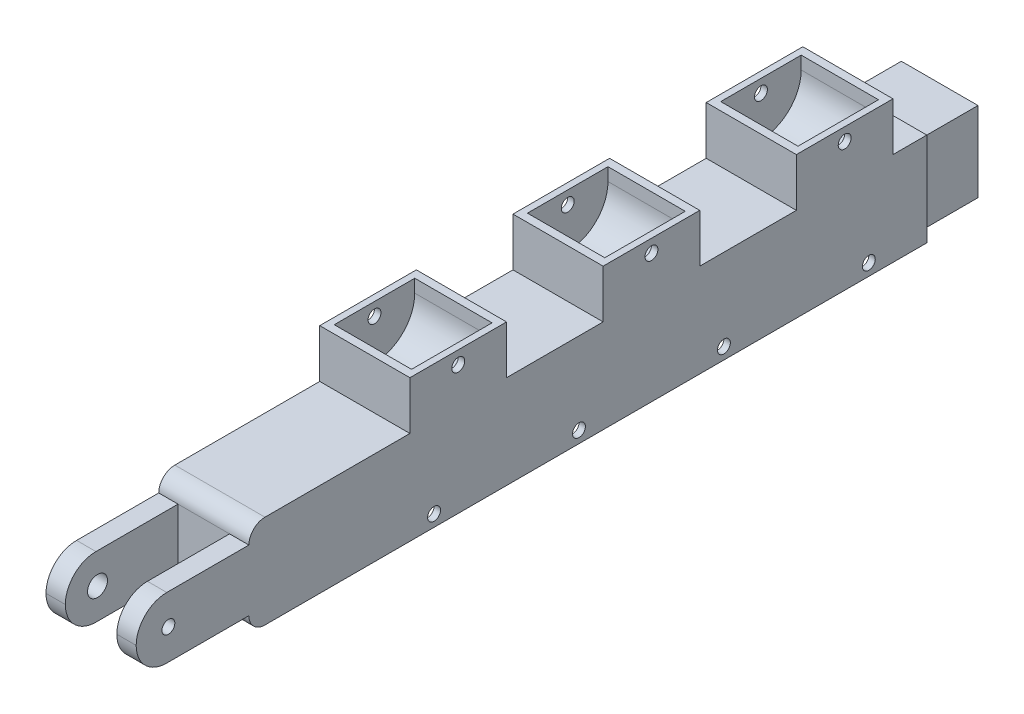
from build123d import *

# Parameters (mm, degrees)
SKETCH_1_W           = 250
SKETCH_1_H           = 29
SKETCH_1_W_2         = 30
SKETCH_1_H_2         = 15
EXTRUDE_1_DEPTH      = 28
SKETCH_1_3_R         = 2
CUT_EXTRUDE_1_DEPTH  = 132.450561049
CUT_EXTRUDE_START    = 2
SKETCH_1_5_R         = 2
CUT_EXTRUDE_2_DEPTH  = 24
SKETCH_3_W           = 6
SKETCH_3_H           = 19
EXTRUDE_2_DEPTH      = 35
SKETCH_3_3_W         = 6
SKETCH_3_3_H         = 19
EXTRUDE_3_DEPTH      = 35
SKETCH_1_6_R         = 2
CUT_EXTRUDE_3_DEPTH  = 166.088612569
CUT_EXTRUDE_7_REACH  = 167.089
SKETCH_1_8_R         = 3.1
FILLET_1_R           = 9.5
FILLET_2_R           = 5
SKETCH_4_R           = 5.1
CUT_EXTRUDE_4_DEPTH  = 31.5
SKETCH_4_2_OUTSIDE_W = 87.946
SKETCH_4_2_OUTSIDE_H = 103.946
SKETCH_4_2_OUTSIDE_R = 5.1
CUT_EXTRUDE_5_DEPTH  = 21.5
SKETCH_5_OUTSIDE_W   = 83.722
SKETCH_5_OUTSIDE_H   = 99.722
SKETCH_5_OUTSIDE_W_2 = 23.8
SKETCH_5_OUTSIDE_H_2 = 24.8
CUT_EXTRUDE_6_DEPTH  = 18


with BuildPart() as part:
    # 草图1 → 凸台-拉伸1 (new body)
    with BuildSketch(Plane(origin=(0, 0, 0), x_dir=(0, 0, -1), z_dir=(1, 0, 0))):
        Rectangle(SKETCH_1_W, SKETCH_1_H)
        with Locations((-60, 22)):
            Rectangle(SKETCH_1_W_2, SKETCH_1_H_2)
        with Locations((0, 22)):
            Rectangle(SKETCH_1_W_2, SKETCH_1_H_2)
        with Locations((60, 22)):
            Rectangle(SKETCH_1_W_2, SKETCH_1_H_2)
    extrude(amount=EXTRUDE_1_DEPTH)

    # 草图1<3> → 切除-拉伸1 (cut, through all)
    with BuildSketch(Plane(origin=(0, 0, 0), x_dir=(0, 0, -1), z_dir=(1, 0, 0))):
        with Locations((-67.5, -10.858617882)):
            Circle(SKETCH_1_3_R)
        with Locations((-22.5, -10.858617882)):
            Circle(SKETCH_1_3_R)
        with Locations((22.5, -10.858617882)):
            Circle(SKETCH_1_3_R)
        with Locations((-60, 25.5)):
            Circle(SKETCH_1_3_R)
        with Locations((67.5, -10.858617882)):
            Circle(SKETCH_1_3_R)
        with Locations((0, 25.5)):
            Circle(SKETCH_1_3_R)
        with Locations((60, 25.5)):
            Circle(SKETCH_1_3_R)
    extrude(amount=CUT_EXTRUDE_1_DEPTH, mode=Mode.SUBTRACT)

    # 草图1<5> → 切除-拉伸2 (cut)
    # profile 1 of 7: a face of its own
    with BuildSketch(Plane(origin=(0, 0, 0), x_dir=(0, 0, -1), z_dir=(1, 0, 0)).offset(CUT_EXTRUDE_START)):
        with BuildLine():
            Line((-72.5, 29.5), (-72.5, 25.5))
            ThreePointArc((-72.5, 25.5), (-60, 13), (-47.5, 25.5))
            Line((-47.5, 25.5), (-47.5, 29.5))
            Line((-47.5, 29.5), (-72.5, 29.5))
        make_face()
        with Locations((-60, 25.5)):
            Circle(SKETCH_1_5_R, mode=Mode.SUBTRACT)
    # profile 2 of 7: a face of its own
    with BuildSketch(Plane(origin=(0, 0, 0), x_dir=(0, 0, -1), z_dir=(1, 0, 0)).offset(CUT_EXTRUDE_START)):
        with BuildLine():
            Line((-79.457856675, -14.5), (-55.542143325, -14.5))
            ThreePointArc((-55.542143325, -14.5), (-67.5, 1.641382118), (-79.457856675, -14.5))
        make_face()
        with Locations((-67.5, -10.858617882)):
            Circle(SKETCH_1_5_R, mode=Mode.SUBTRACT)
    # profile 3 of 7: a face of its own
    with BuildSketch(Plane(origin=(0, 0, 0), x_dir=(0, 0, -1), z_dir=(1, 0, 0)).offset(CUT_EXTRUDE_START)):
        with BuildLine():
            Line((-34.457856675, -14.5), (-10.542143325, -14.5))
            ThreePointArc((-10.542143325, -14.5), (-22.5, 1.641382118), (-34.457856675, -14.5))
        make_face()
        with Locations((-22.5, -10.858617882)):
            Circle(SKETCH_1_5_R, mode=Mode.SUBTRACT)
    # profile 4 of 7: a face of its own
    with BuildSketch(Plane(origin=(0, 0, 0), x_dir=(0, 0, -1), z_dir=(1, 0, 0)).offset(CUT_EXTRUDE_START)):
        with BuildLine():
            ThreePointArc((-12.5, 25.5), (0, 13), (12.5, 25.5))
            Line((12.5, 25.5), (12.5, 29.5))
            Line((12.5, 29.5), (-12.5, 29.5))
            Line((-12.5, 29.5), (-12.5, 25.5))
        make_face()
        with Locations((0, 25.5)):
            Circle(SKETCH_1_5_R, mode=Mode.SUBTRACT)
    # profile 5 of 7: a face of its own
    with BuildSketch(Plane(origin=(0, 0, 0), x_dir=(0, 0, -1), z_dir=(1, 0, 0)).offset(CUT_EXTRUDE_START)):
        with BuildLine():
            Line((10.542143325, -14.5), (34.457856675, -14.5))
            ThreePointArc((34.457856675, -14.5), (22.5, 1.641382118), (10.542143325, -14.5))
        make_face()
        with Locations((22.5, -10.858617882)):
            Circle(SKETCH_1_5_R, mode=Mode.SUBTRACT)
    # profile 6 of 7: a face of its own
    with BuildSketch(Plane(origin=(0, 0, 0), x_dir=(0, 0, -1), z_dir=(1, 0, 0)).offset(CUT_EXTRUDE_START)):
        with BuildLine():
            Line((55.542143325, -14.5), (79.457856675, -14.5))
            ThreePointArc((79.457856675, -14.5), (67.5, 1.641382118), (55.542143325, -14.5))
        make_face()
        with Locations((67.5, -10.858617882)):
            Circle(SKETCH_1_5_R, mode=Mode.SUBTRACT)
    # profile 7 of 7: a face of its own
    with BuildSketch(Plane(origin=(0, 0, 0), x_dir=(0, 0, -1), z_dir=(1, 0, 0)).offset(CUT_EXTRUDE_START)):
        with BuildLine():
            ThreePointArc((47.5, 25.5), (60, 13), (72.5, 25.5))
            Line((72.5, 25.5), (72.5, 29.5))
            Line((72.5, 29.5), (47.5, 29.5))
            Line((47.5, 29.5), (47.5, 25.5))
        make_face()
        with Locations((60, 25.5)):
            Circle(SKETCH_1_5_R, mode=Mode.SUBTRACT)
    extrude(amount=CUT_EXTRUDE_2_DEPTH, mode=Mode.SUBTRACT)

    # 草图3 → 凸台-拉伸2 (add)
    with BuildSketch(Plane.XY.offset(125)):
        with Locations((25, 0)):
            Rectangle(SKETCH_3_W, SKETCH_3_H)
    extrude(amount=EXTRUDE_2_DEPTH)

    # 草图3<3> → 凸台-拉伸3 (add)
    with BuildSketch(Plane.XY.offset(125)):
        with Locations((25, 0)):
            Rectangle(SKETCH_3_3_W, SKETCH_3_3_H)
        with Locations((3, 0)):
            Rectangle(SKETCH_3_3_W, SKETCH_3_3_H)
    extrude(amount=EXTRUDE_3_DEPTH)

    # 草图1<6> → 切除-拉伸3 (cut, through all)
    with BuildSketch(Plane(origin=(0, 0, 0), x_dir=(0, 0, -1), z_dir=(1, 0, 0))):
        with Locations(Location((-150, 0, 0), (0, 0, 90))):
            Circle(SKETCH_1_6_R)
    extrude(amount=CUT_EXTRUDE_3_DEPTH, mode=Mode.SUBTRACT)

    # 草图1<8> → 切除-拉伸7 (cut, up to next)
    with BuildSketch(Plane(origin=(0, 0, 0), x_dir=(0, 0, -1), z_dir=(1, 0, 0)), mode=Mode.PRIVATE) as cut_extrude_7_sk1:
        with Locations(Location((-150, 0, 0), (0, 0, 180))):
            Circle(SKETCH_1_8_R)
    cut_extrude_7_tool1 = extrude(cut_extrude_7_sk1.sketch, amount=CUT_EXTRUDE_7_REACH, mode=Mode.PRIVATE) & part.part
    add(cut_extrude_7_tool1.solids().sort_by_distance((0, 0, 150))[0], mode=Mode.SUBTRACT)

    # 圆角1
    fillet_1_edges = [part.edges().sort_by_distance(p)[0] for p in [
        (25, 9.5, 160),
        (25, -9.5, 160),
        (3, -9.5, 160),
        (3, 9.5, 160),
    ]]
    fillet(fillet_1_edges, radius=FILLET_1_R - 0.0001)  # a hair under: the kernel refuses the full size

    # 圆角2
    fillet_2_edges = [part.edges().sort_by_distance(p)[0] for p in [
        (14, -14.5, 125),
        (14, 14.5, 125),
    ]]
    fillet(fillet_2_edges, radius=FILLET_2_R)

    # 草图4 → 切除-拉伸4 (cut)
    with BuildSketch(Plane(origin=(0, 0, -125), x_dir=(-1, 0, 0), z_dir=(0, 0, -1))):
        with Locations((-14, 0)):
            Circle(SKETCH_4_R)
    extrude(amount=-CUT_EXTRUDE_4_DEPTH, mode=Mode.SUBTRACT)

    # 草图4<2> outside → 切除-拉伸5 (cut)
    with BuildSketch(Plane(origin=(0, 0, -125), x_dir=(-1, 0, 0), z_dir=(0, 0, -1))):
        with Locations((-14, 7.5)):
            Rectangle(SKETCH_4_2_OUTSIDE_W, SKETCH_4_2_OUTSIDE_H)
        with Locations((-14, 0)):
            Circle(SKETCH_4_2_OUTSIDE_R, mode=Mode.SUBTRACT)
    extrude(amount=-CUT_EXTRUDE_5_DEPTH, mode=Mode.SUBTRACT)

    # 草图5 outside → 切除-拉伸6 (cut)
    with BuildSketch(Plane(origin=(0, 0, -103.5), x_dir=(-1, 0, 0), z_dir=(0, 0, -1))):
        with Locations((-14, 7.5)):
            Rectangle(SKETCH_5_OUTSIDE_W, SKETCH_5_OUTSIDE_H)
        with Locations((-14, 0)):
            Rectangle(SKETCH_5_OUTSIDE_W_2, SKETCH_5_OUTSIDE_H_2, mode=Mode.SUBTRACT)
    extrude(amount=-CUT_EXTRUDE_6_DEPTH, mode=Mode.SUBTRACT)


solid = part.part
